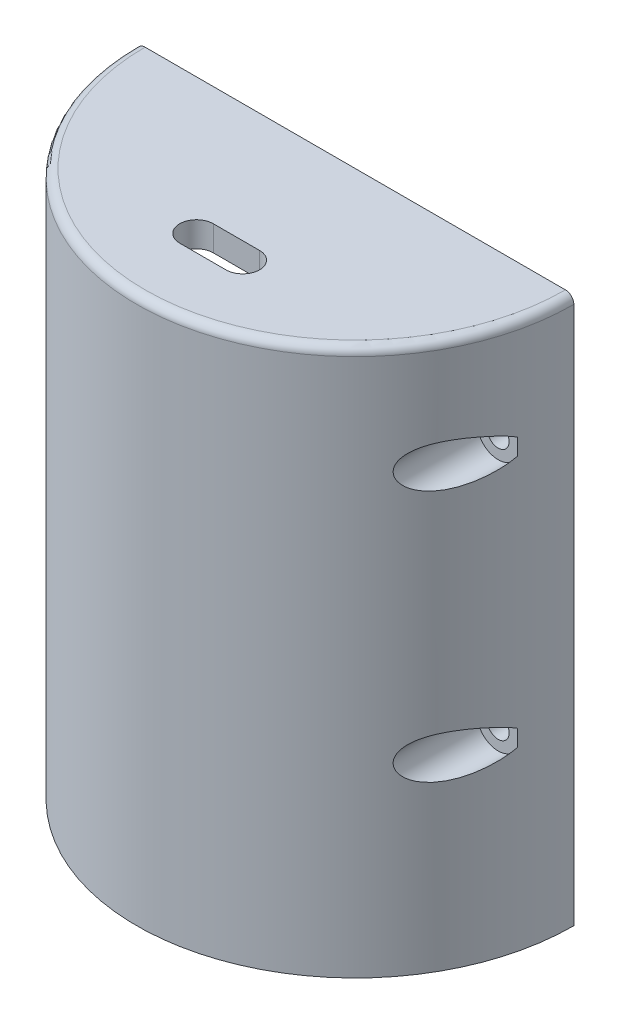
from build123d import *

# Parameters (mm, degrees)
EXTRUDE_1_DEPTH     = 65
EXTRUDE_5_REACH     = 76.679
SKETCH_12_R         = 3
SKETCH_16_R         = 1.3
CUT_EXTRUDE_2_DEPTH = 75.679314492
EXTRUDE_START       = -3
EXTRUDE_6_DEPTH     = 3
FILLET_1_R          = 1
CUT_EXTRUDE_3_REACH = 76.679
CUT_EXTRUDE_START   = -6
SKETCH_16_4_R       = 2.5
CUT_EXTRUDE_4_DEPTH = 69.679314475


with BuildPart() as part:
    # Эскиз1 → Бобышка-Вытянуть1 (new body)
    with BuildSketch(Plane(origin=(0, 0, 0), x_dir=(1, 0, 0), z_dir=(0, 1, 0))):
        with BuildLine():
            Line((-26, 0), (-23, 0))
            ThreePointArc((-23, 0), (0, -23), (23, 0))
            Line((23, 0), (26, 0))
            ThreePointArc((26, 0), (0, -26), (-26, 0))
        make_face()
    extrude(amount=EXTRUDE_1_DEPTH)

    # Эскиз12 → Бобышка-Вытянуть5 (add, up to next)
    with BuildSketch(Plane(origin=(0, 0, 0), x_dir=(-1, 0, 0), z_dir=(0, 0, -1)), mode=Mode.PRIVATE) as extrude_5_sk1:
        with Locations((23, 52)):
            Circle(SKETCH_12_R)
    extrude_5_tool1 = extrude(extrude_5_sk1.sketch, amount=-EXTRUDE_5_REACH, mode=Mode.PRIVATE) - part.part
    # Эскиз12 → Бобышка-Вытянуть5 (add, up to next)
    with BuildSketch(Plane(origin=(0, 0, 0), x_dir=(-1, 0, 0), z_dir=(0, 0, -1)), mode=Mode.PRIVATE) as extrude_5_sk2:
        with Locations((23, 22)):
            Circle(SKETCH_12_R)
    extrude_5_tool2 = extrude(extrude_5_sk2.sketch, amount=-EXTRUDE_5_REACH, mode=Mode.PRIVATE) - part.part
    # Эскиз12 → Бобышка-Вытянуть5 (add, up to next)
    with BuildSketch(Plane(origin=(0, 0, 0), x_dir=(-1, 0, 0), z_dir=(0, 0, -1)), mode=Mode.PRIVATE) as extrude_5_sk3:
        with Locations((-23, 52)):
            Circle(SKETCH_12_R)
    extrude_5_tool3 = extrude(extrude_5_sk3.sketch, amount=-EXTRUDE_5_REACH, mode=Mode.PRIVATE) - part.part
    # Эскиз12 → Бобышка-Вытянуть5 (add, up to next)
    with BuildSketch(Plane(origin=(0, 0, 0), x_dir=(-1, 0, 0), z_dir=(0, 0, -1)), mode=Mode.PRIVATE) as extrude_5_sk4:
        with Locations((-23, 22)):
            Circle(SKETCH_12_R)
    extrude_5_tool4 = extrude(extrude_5_sk4.sketch, amount=-EXTRUDE_5_REACH, mode=Mode.PRIVATE) - part.part
    add(extrude_5_tool1.solids().sort_by_distance((-23, 52, 0))[0])
    add(extrude_5_tool2.solids().sort_by_distance((-23, 22, 0))[0])
    add(extrude_5_tool3.solids().sort_by_distance((23, 52, 0))[0])
    add(extrude_5_tool4.solids().sort_by_distance((23, 22, 0))[0])

    # Эскиз16 → Вырез-Вытянуть2 (cut, through all)
    with BuildSketch(Plane(origin=(0, 0, 0), x_dir=(-1, 0, 0), z_dir=(0, 0, -1))):
        with Locations((23, 52)):
            Circle(SKETCH_16_R)
        with Locations((23, 22)):
            Circle(SKETCH_16_R)
        with Locations((-23, 22)):
            Circle(SKETCH_16_R)
        with Locations((-23, 52)):
            Circle(SKETCH_16_R)
    extrude(amount=-CUT_EXTRUDE_2_DEPTH, mode=Mode.SUBTRACT)

    # Эскиз2 → Бобышка-Вытянуть6 (add)
    with BuildSketch(Plane(origin=(0, 65, 0), x_dir=(1, 0, 0), z_dir=(0, 1, 0)).offset(EXTRUDE_START)):
        with BuildLine():
            Line((-26, 0), (26, 0))
            ThreePointArc((26, 0), (0, -26), (-26, 0))
        make_face()
    extrude(amount=EXTRUDE_6_DEPTH)

    # Скругление1
    fillet_1_edges = [part.edges().sort_by_distance(p)[0] for p in [
        (0, 65, 26),
    ]]
    fillet(fillet_1_edges, radius=FILLET_1_R)

    # Эскиз18 → Вырез-Вытянуть3 (cut, up to next)
    with BuildSketch(Plane(origin=(0, 65, 0), x_dir=(1, 0, 0), z_dir=(0, 1, 0)), mode=Mode.PRIVATE) as cut_extrude_3_sk1:
        with BuildLine():
            Line((-2.75, -14.13), (2.75, -14.13))
            ThreePointArc((2.75, -14.13), (4.75, -16.13), (2.75, -18.13))
            Line((2.75, -18.13), (-2.75, -18.13))
            ThreePointArc((-2.75, -18.13), (-4.75, -16.13), (-2.75, -14.13))
        make_face()
    cut_extrude_3_tool1 = extrude(cut_extrude_3_sk1.sketch, amount=-CUT_EXTRUDE_3_REACH, mode=Mode.PRIVATE) & part.part
    add(cut_extrude_3_tool1.solids().sort_by_distance((0, 65, 16.13))[0], mode=Mode.SUBTRACT)

    # Эскиз16<4> → Вырез-Вытянуть4 (cut, through all)
    with BuildSketch(Plane(origin=(0, 0, 0), x_dir=(-1, 0, 0), z_dir=(0, 0, -1)).offset(CUT_EXTRUDE_START)):
        with Locations((-23, 52)):
            Circle(SKETCH_16_4_R)
        with Locations((-23, 22)):
            Circle(SKETCH_16_4_R)
        with Locations((23, 22)):
            Circle(SKETCH_16_4_R)
        with Locations((23, 52)):
            Circle(SKETCH_16_4_R)
    extrude(amount=-CUT_EXTRUDE_4_DEPTH, mode=Mode.SUBTRACT)


solid = part.part
